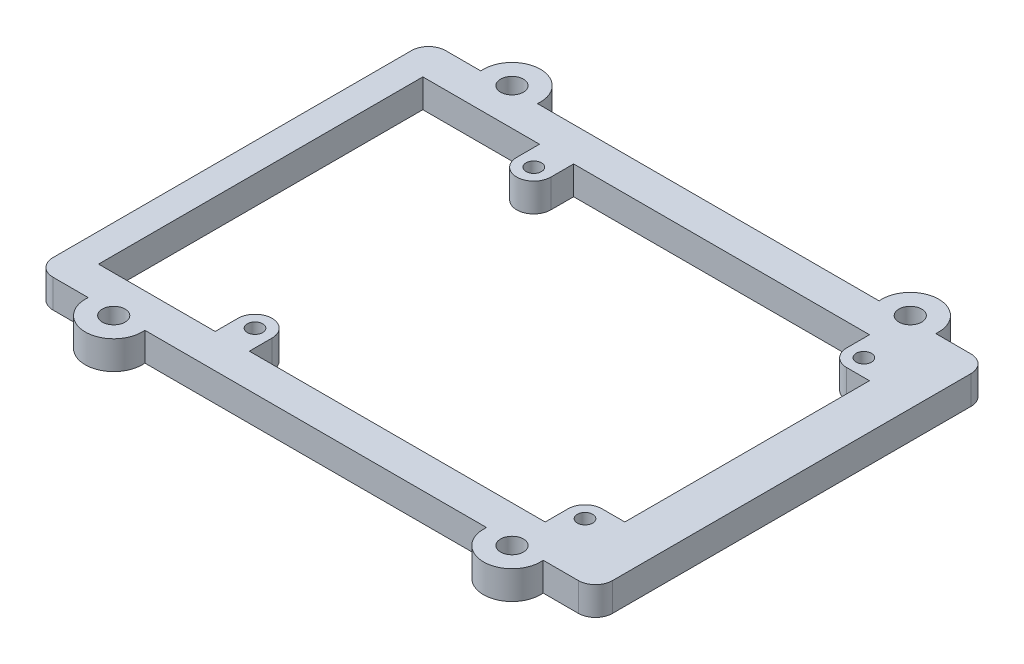
from build123d import *

# Parameters (mm, degrees)
ESQUISSE1_R             = 1.35
BOSS_EXTRU_1_DEPTH      = 5
ENL_V_MAT_EXTRU_1_DEPTH = 5
ESQUISSE3_R             = 5
ESQUISSE3_R_2           = 2
BOSS_EXTRU_2_DEPTH      = 5
ESQUISSE4_R             = 2
ENL_V_MAT_EXTRU_2_DEPTH = 5
CONG_1_R                = 3


with BuildPart() as part:
    # Esquisse1 → Boss.-Extru.1 (new body)
    with BuildSketch(Plane(origin=(0, 0, 0), x_dir=(1, 0, 0), z_dir=(0, 1, 0))):
        Polygon((-40.836734694, -34.5), (40.836734694, -34.5), (40.836734694, 34.5), (-40.836734694, 34.5), (-57.5, 34.5), (-57.5, -34.5), align=None)
        with Locations((-29, 24.5)):
            Circle(ESQUISSE1_R, mode=Mode.SUBTRACT)
        with Locations((29, 24.5)):
            Circle(ESQUISSE1_R, mode=Mode.SUBTRACT)
        with Locations((29, -24.5)):
            Circle(ESQUISSE1_R, mode=Mode.SUBTRACT)
        with Locations((-29, -24.5)):
            Circle(ESQUISSE1_R, mode=Mode.SUBTRACT)
    extrude(amount=BOSS_EXTRU_1_DEPTH)

    # Esquisse2 → Enlèv. mat.-Extru.1 (cut)
    with BuildSketch(Plane(origin=(0, 5, 0), x_dir=(1, 0, 0), z_dir=(0, 1, 0))):
        with BuildLine():
            Line((-32, 24.5), (-32, 28.5))
            Line((-32, 28.5), (-52.5, 28.5))
            Line((-52.5, 28.5), (-52.5, -28.5))
            Line((-52.5, -28.5), (-32, -28.5))
            Line((-32, -28.5), (-32, -24.5))
            ThreePointArc((-32, -24.5), (-29, -21.5), (-26, -24.5))
            Line((-26, -24.5), (-26, -28.5))
            Line((-26, -28.5), (26, -28.5))
            Line((26, -28.5), (26, -24.5))
            ThreePointArc((26, -24.5), (26.878679656, -22.378679656), (29, -21.5))
            Line((29, -21.5), (33, -21.5))
            Line((33, -21.5), (33, 21.5))
            Line((33, 21.5), (29, 21.5))
            ThreePointArc((29, 21.5), (26.878679656, 22.378679656), (26, 24.5))
            Line((26, 24.5), (26, 28.5))
            Line((26, 28.5), (-26, 28.5))
            Line((-26, 28.5), (-26, 24.5))
            ThreePointArc((-26, 24.5), (-29, 21.5), (-32, 24.5))
        make_face()
    extrude(amount=-ENL_V_MAT_EXTRU_1_DEPTH, mode=Mode.SUBTRACT)

    # Esquisse3 → Boss.-Extru.2 (add)
    # profile 1 of 4: a face of its own
    with BuildSketch(Plane(origin=(0, 5, 0), x_dir=(1, 0, 0), z_dir=(0, 1, 0))):
        with Locations((-43.331632653, 35)):
            Circle(ESQUISSE3_R)
        with Locations((-43.331632653, 35)):
            Circle(ESQUISSE3_R_2, mode=Mode.SUBTRACT)
    # profile 2 of 4: a face of its own
    with BuildSketch(Plane(origin=(0, 5, 0), x_dir=(1, 0, 0), z_dir=(0, 1, 0))):
        with Locations((26.668367347, 35)):
            Circle(ESQUISSE3_R)
        with Locations((26.668367347, 35)):
            Circle(ESQUISSE3_R_2, mode=Mode.SUBTRACT)
    # profile 3 of 4: a face of its own
    with BuildSketch(Plane(origin=(0, 5, 0), x_dir=(1, 0, 0), z_dir=(0, 1, 0))):
        with Locations((26.668367347, -35)):
            Circle(ESQUISSE3_R)
        with Locations((26.668367347, -35)):
            Circle(ESQUISSE3_R_2, mode=Mode.SUBTRACT)
    # profile 4 of 4: a face of its own
    with BuildSketch(Plane(origin=(0, 5, 0), x_dir=(1, 0, 0), z_dir=(0, 1, 0))):
        with Locations((-43.331632653, -35)):
            Circle(ESQUISSE3_R)
        with Locations((-43.331632653, -35)):
            Circle(ESQUISSE3_R_2, mode=Mode.SUBTRACT)
    extrude(amount=-BOSS_EXTRU_2_DEPTH)

    # Esquisse4 → Enlèv. mat.-Extru.2 (cut)
    with BuildSketch(Plane(origin=(0, 5, 0), x_dir=(1, 0, 0), z_dir=(0, 1, 0))):
        with Locations((-43.331632653, 35)):
            Circle(ESQUISSE4_R)
        with Locations((26.668367347, 35)):
            Circle(ESQUISSE4_R)
        with Locations((26.668367347, -35)):
            Circle(ESQUISSE4_R)
        with Locations((-43.331632653, -35)):
            Circle(ESQUISSE4_R)
    extrude(amount=-ENL_V_MAT_EXTRU_2_DEPTH, mode=Mode.SUBTRACT)

    # Congé1
    cong_1_edges = [part.edges().sort_by_distance(p)[0] for p in [
        (-57.5, 2.5, 34.5),
        (-57.5, 2.5, -34.5),
        (40.836734694, 2.5, 34.5),
        (40.836734694, 2.5, -34.5),
    ]]
    fillet(cong_1_edges, radius=CONG_1_R)


solid = part.part
